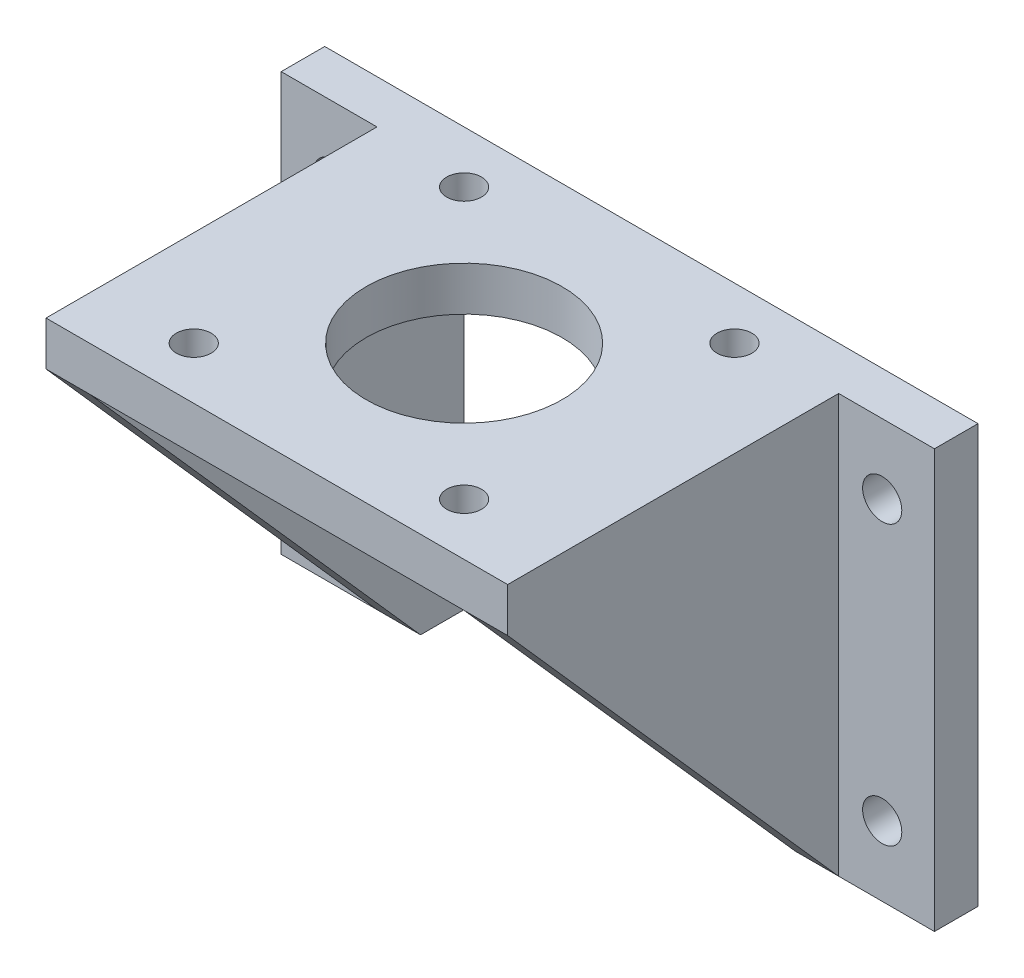
from build123d import *

# Parameters (mm, degrees)
SKETCH1_R           = 2.25
BOSS_EXTRUDE1_DEPTH = 5
SKETCH2_W           = 53
SKETCH2_H           = 5.069282957
BOSS_EXTRUDE2_DEPTH = 38
BOSS_EXTRUDE3_DEPTH = 5
BOSS_EXTRUDE4_DEPTH = 5
SKETCH5_R           = 11.25
SKETCH5_R_2         = 2
CUT_EXTRUDE1_DEPTH  = 88.372764635


with BuildPart() as part:
    # Sketch1 → Boss-Extrude1 (new body)
    with BuildSketch(Plane.XY):
        Polygon((0, 0), (0, 43), (43, 43), (43, 0), (59, 0), (59, 48), (-16, 48), (-16, 0), align=None)
        with Locations((-10, 40)):
            Circle(SKETCH1_R, mode=Mode.SUBTRACT)
        with Locations((53, 40)):
            Circle(SKETCH1_R, mode=Mode.SUBTRACT)
        with Locations((53, 8)):
            Circle(SKETCH1_R, mode=Mode.SUBTRACT)
        with Locations((-10, 8)):
            Circle(SKETCH1_R, mode=Mode.SUBTRACT)
    extrude(amount=BOSS_EXTRUDE1_DEPTH)

    # Sketch2 → Boss-Extrude2 (add)
    with BuildSketch(Plane.XY.offset(5)):
        with Locations((21.5, 45.465358522)):
            Rectangle(SKETCH2_W, SKETCH2_H)
    extrude(amount=BOSS_EXTRUDE2_DEPTH)

    # Sketch3 → Boss-Extrude3 (add)
    with BuildSketch(Plane.ZY.offset(5)):
        Polygon((5, 48), (5, 0), (43, 42.930717043), (43, 48), align=None)
    extrude(amount=-BOSS_EXTRUDE3_DEPTH)

    # Sketch4 → Boss-Extrude4 (add)
    with BuildSketch(Plane(origin=(48, 0, 0), x_dir=(0, 0, -1), z_dir=(1, 0, 0))):
        Polygon((-43, 48), (-43, 42.930717043), (-5, 0), (-5, 48), align=None)
    extrude(amount=-BOSS_EXTRUDE4_DEPTH)

    # Sketch5 → Cut-Extrude1 (cut, through all)
    with BuildSketch(Plane(origin=(0, 48, 0), x_dir=(1, 0, 0), z_dir=(0, 1, 0))):
        with Locations((21.5, -21.5)):
            Circle(SKETCH5_R)
        with Locations((5.98, -5.98)):
            Circle(SKETCH5_R_2)
        with Locations((37.02, -5.98)):
            Circle(SKETCH5_R_2)
        with Locations((37.02, -37.02)):
            Circle(SKETCH5_R_2)
        with Locations((5.98, -37.02)):
            Circle(SKETCH5_R_2)
    extrude(amount=-CUT_EXTRUDE1_DEPTH, mode=Mode.SUBTRACT)


solid = part.part
